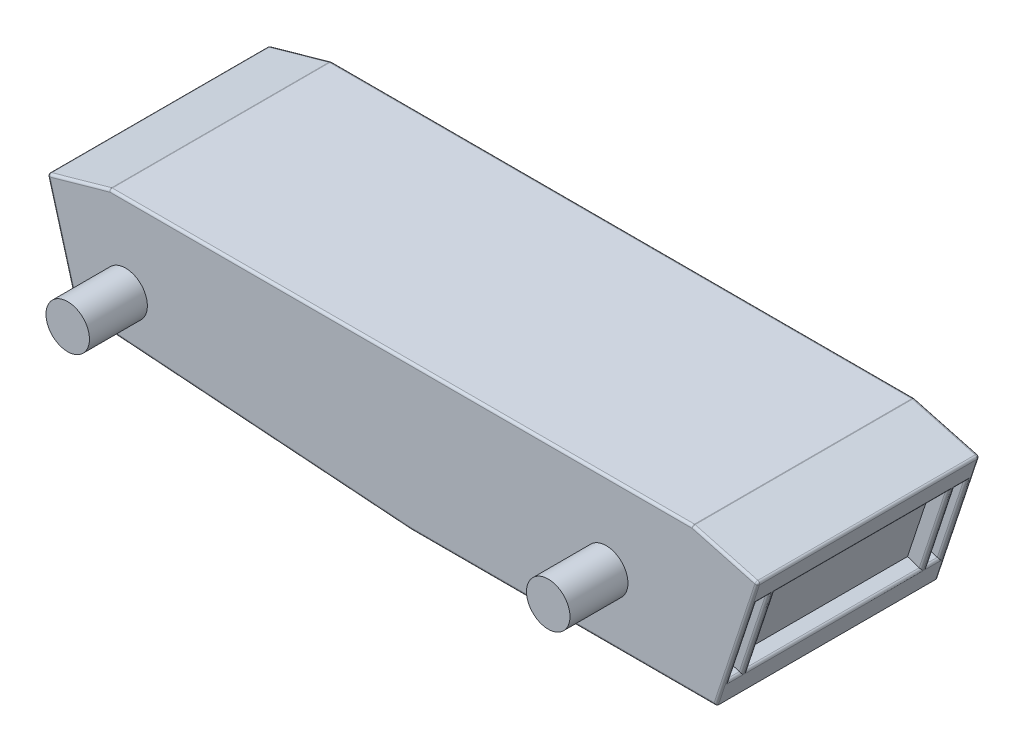
from build123d import *

# Parameters (mm, degrees)
BOSS_EXTRUDE1_DEPTH      = 116.84
BOSS_EXTRUDE1_DEPTH_BACK = 116.84
SKETCH4_W                = 182.88
SKETCH4_H                = 90.042714046
SKETCH4_W_2              = 12.7
CUT_EXTRUDE1_DEPTH       = 15.494
FILLET1_R                = 2.54
FILLET2_R                = 2.54
CUT_EXTRUDE2_DEPTH       = 101.6
CUT_EXTRUDE2_DEPTH_BACK  = 101.6
FILLET3_R                = 2.54
SKETCH6_W                = 177.8
SKETCH6_H                = 57.631536049
CUT_EXTRUDE3_DEPTH       = 13.97
FILLET4_R                = 2.54
BOSS_EXTRUDE3_DEPTH      = 177.8
BOSS_EXTRUDE3_DEPTH_BACK = 177.8
SKETCH8_R                = 22.86
CUT_EXTRUDE4_DEPTH       = 118.364


with BuildPart() as part:
    # Sketch3 → Boss-Extrude1 (new, two sides: drawn at the far end of the back side and taken through both)
    with BuildSketch(Plane.XY.offset(-BOSS_EXTRUDE1_DEPTH_BACK)):
        Polygon((412.345301331, 143.176532362), (343.429290034, 161.691281666), (-269.614631353, 161.691281666), (-335.444851099, 143.176532362), (-304.916459035, 34.631138356), (47.193301176, 9.458898503), (368.115622439, 9.458898503), align=None)
    extrude(amount=BOSS_EXTRUDE1_DEPTH + BOSS_EXTRUDE1_DEPTH_BACK)

    # Sketch4 → Cut-Extrude1 (cut)
    with BuildSketch(Plane(origin=(328.992414347, -108.820567822, 0), x_dir=(0, 0, -1), z_dir=(0.9494110843087806, -0.3140359740405954, 0))):
        with Locations((0, 195.003288159)):
            Rectangle(SKETCH4_W, SKETCH4_H)
        with Locations((-104.14, 195.003288159)):
            Rectangle(SKETCH4_W_2, SKETCH4_H)
        with Locations((104.14, 195.003288159)):
            Rectangle(SKETCH4_W_2, SKETCH4_H)
    extrude(amount=-CUT_EXTRUDE1_DEPTH, mode=Mode.SUBTRACT)

    # Fillet1
    fillet1_edges = [part.edges().sort_by_distance(p)[0] for p in [
        (404.36878759, 119.061490821, -104.14),
        (390.230461885, 76.317715433, -110.49),
        (361.381960839, 38.439613426, -104.14),
        (375.520286544, 81.183388814, -97.79),
        (389.65861225, 123.927164203, -104.14),
        (375.520286544, 81.183388814, -110.49),
        (390.230461885, 76.317715433, -97.79),
        (376.092136179, 33.573940044, -104.14),
        (390.230461885, 76.317715433, 97.79),
        (376.092136179, 33.573940044, 104.14),
        (375.520286544, 81.183388814, 110.49),
        (389.65861225, 123.927164203, 104.14),
        (375.520286544, 81.183388814, 97.79),
        (361.381960839, 38.439613426, 104.14),
        (404.36878759, 119.061490821, 104.14),
        (390.230461885, 76.317715433, 110.49),
    ]]
    fillet(fillet1_edges, radius=FILLET1_R)

    # Fillet2
    fillet2_edges = [part.edges().sort_by_distance(p)[0] for p in [
        (390.230461885, 76.317715433, -91.44),
        (404.36878759, 119.061490821, 0),
        (390.230461885, 76.317715433, 91.44),
        (376.092136179, 33.573940044, 0),
    ]]
    fillet(fillet2_edges, radius=FILLET2_R)

    # Sketch5 → Cut-Extrude2 (cut, two sides: drawn at the far end of the back side and taken through both)
    with BuildSketch(Plane.XY.offset(-CUT_EXTRUDE2_DEPTH_BACK)):
        Polygon((379.785771188, 125.623196843), (340.076788789, 136.291281666), (-266.110728793, 136.291281666), (-304.116579565, 125.602136136), (-285.29852031, 58.693481005), (48.100063951, 34.858898503), (349.763734045, 34.858898503), align=None)
    extrude(amount=CUT_EXTRUDE2_DEPTH + CUT_EXTRUDE2_DEPTH_BACK, mode=Mode.SUBTRACT)

    # Fillet3
    # the kernel refuses this fillet: 2.54 mm, written as the material it adds along each edge
    with BuildSketch(Plane(origin=(48.100063951, 34.858898503, 101.826690694), x_dir=(1, 0, 0), z_dir=(0, 0, -1))) as fillet3_piece_1:
        with BuildLine():
            CenterArc((FILLET3_R * 0.0356993218371, -FILLET3_R), FILLET3_R, 90, 4.089104427)
            Line((-FILLET3_R * 0.0356084442551, -FILLET3_R * 0.00254563889121), (0, 0))
            Line((0, 0), (FILLET3_R * 0.0356993218371, 0))
        make_face()
    extrude(amount=203.653381387)
    # the kernel refuses this fillet: 2.54 mm, written as the material it takes off along each edge
    with BuildSketch(Plane(origin=(47.283977453, 11.998898503, 114.3), x_dir=(-0.07130776609221037, -0.9974543611087873, 0), z_dir=(0, 0, 1))) as fillet3_2_piece_1_section:
        Polygon((0, 0), (FILLET3_R * 1.02, 0), (FILLET3_R * 1.02, FILLET3_R * 0.0364133082739), (FILLET3_R * 1.01740344833, FILLET3_R * 0.0727339214141), align=None)
    fillet3_2_piece_1 = extrude(amount=FILLET3_R * 1.02, mode=Mode.PRIVATE)
    fillet3_2_piece_1 = fillet3_2_piece_1 - Plane(origin=(47.283977453, 11.998898503, 114.3), x_dir=(0.035676595207593184, 0.9993633876395481, 0), z_dir=(0, 0, 1)) * Sphere(FILLET3_R, mode=Mode.PRIVATE)
    add(fillet3_2_piece_1, mode=Mode.SUBTRACT)
    with BuildSketch(Plane(origin=(47.283977453, 11.998898503, -114.3), x_dir=(-0.07130776609221037, -0.9974543611087873, 0), z_dir=(0, 0, -1))) as fillet3_2_piece_2_section:
        Polygon((0, 0), (FILLET3_R * 1.02, 0), (FILLET3_R * 1.02, -FILLET3_R * 0.0364133082739), (FILLET3_R * 1.01740344833, -FILLET3_R * 0.0727339214141), align=None)
    fillet3_2_piece_2 = extrude(amount=FILLET3_R * 1.02, mode=Mode.PRIVATE)
    fillet3_2_piece_2 = fillet3_2_piece_2 - Plane(origin=(47.283977453, 11.998898503, -114.3), x_dir=(0.035676595207593184, 0.9993633876395481, 0), z_dir=(0, 0, -1)) * Sphere(FILLET3_R, mode=Mode.PRIVATE)
    add(fillet3_2_piece_2, mode=Mode.SUBTRACT)
    with BuildSketch(Plane(origin=(-302.954665162, 37.03737262, -114.3), x_dir=(-0.9626509401538987, -0.27074557691828516, 0), z_dir=(0, 0, -1))) as fillet3_2_piece_3_section:
        Polygon((0, 0), (FILLET3_R * 1.02, 0), (FILLET3_R * 1.02, -FILLET3_R * 0.716898030256), (FILLET3_R * 0.345474861407, -FILLET3_R * 0.959711998537), align=None)
    fillet3_2_piece_3 = extrude(amount=FILLET3_R * 1.02, mode=Mode.PRIVATE)
    fillet3_2_piece_3 = fillet3_2_piece_3 - Plane(origin=(-302.954665162, 37.03737262, -114.3), x_dir=(0.6318971956026084, 0.7750522138472729, 0), z_dir=(0, 0, -1)) * Sphere(FILLET3_R, mode=Mode.PRIVATE)
    add(fillet3_2_piece_3, mode=Mode.SUBTRACT)
    with BuildSketch(Plane(origin=(-302.954665162, 37.03737262, 114.3), x_dir=(-0.9626509401538987, -0.27074557691828516, 0), z_dir=(0, 0, 1))) as fillet3_2_piece_4_section:
        Polygon((0, 0), (FILLET3_R * 1.02, 0), (FILLET3_R * 1.02, FILLET3_R * 0.716898030256), (FILLET3_R * 0.345474861407, FILLET3_R * 0.959711998537), align=None)
    fillet3_2_piece_4 = extrude(amount=FILLET3_R * 1.02, mode=Mode.PRIVATE)
    fillet3_2_piece_4 = fillet3_2_piece_4 - Plane(origin=(-302.954665162, 37.03737262, 114.3), x_dir=(0.6318971956026084, 0.7750522138472729, 0), z_dir=(0, 0, 1)) * Sphere(FILLET3_R, mode=Mode.PRIVATE)
    add(fillet3_2_piece_4, mode=Mode.SUBTRACT)
    with BuildSketch(Plane(origin=(343.094039909, 159.151281666, -114.3), x_dir=(0.25945651134605857, 0.9657547922325483, 0), z_dir=(0, 0, -1))) as fillet3_2_piece_5_section:
        Polygon((0, 0), (FILLET3_R * 1.02, 0), (FILLET3_R * 1.02, -FILLET3_R * 0.134628002749), (FILLET3_R * 0.985069888077, -FILLET3_R * 0.264645641573), align=None)
    fillet3_2_piece_5 = extrude(amount=FILLET3_R * 1.02, mode=Mode.PRIVATE)
    fillet3_2_piece_5 = fillet3_2_piece_5 - Plane(origin=(343.094039909, 159.151281666, -114.3), x_dir=(-0.13085336787307325, -0.9914017329600923, 0), z_dir=(0, 0, -1)) * Sphere(FILLET3_R, mode=Mode.PRIVATE)
    add(fillet3_2_piece_5, mode=Mode.SUBTRACT)
    with BuildSketch(Plane(origin=(-269.264241097, 159.151281666, -114.3), x_dir=(-0.270745576918285, 0.9626509401538987, 0), z_dir=(0, 0, -1))) as fillet3_2_piece_6_section:
        Polygon((0, 0), (FILLET3_R * 1.02, 0), (FILLET3_R * 1.02, FILLET3_R * 0.140707898081), (FILLET3_R * 0.981903958957, FILLET3_R * 0.276160488457), align=None)
    fillet3_2_piece_6 = extrude(amount=FILLET3_R * 1.02, mode=Mode.PRIVATE)
    fillet3_2_piece_6 = fillet3_2_piece_6 - Plane(origin=(-269.264241097, 159.151281666, -114.3), x_dir=(0.13665478375472503, -0.9906187309338288, 0), z_dir=(0, 0, -1)) * Sphere(FILLET3_R, mode=Mode.PRIVATE)
    add(fillet3_2_piece_6, mode=Mode.SUBTRACT)
    with BuildSketch(Plane(origin=(-332.312023946, 141.41909274, -114.3), x_dir=(-0.270745576918285, 0.9626509401538987, 0), z_dir=(0, 0, -1))) as fillet3_2_piece_7_section:
        Polygon((0, 0), (FILLET3_R * 1.02, 0), (FILLET3_R * 1.02, -FILLET3_R * 1.02), (0, -FILLET3_R * 1.02), align=None)
    fillet3_2_piece_7 = extrude(amount=FILLET3_R * 1.02, mode=Mode.PRIVATE)
    fillet3_2_piece_7 = fillet3_2_piece_7 - Plane(origin=(-332.312023946, 141.41909274, -114.3), x_dir=(0.8721430411136103, -0.48925097428324366, 0), z_dir=(0, 0, -1)) * Sphere(FILLET3_R, mode=Mode.PRIVATE)
    add(fillet3_2_piece_7, mode=Mode.SUBTRACT)
    with BuildSketch(Plane(origin=(-332.312023946, 141.41909274, 114.3), x_dir=(-0.270745576918285, 0.9626509401538987, 0), z_dir=(0, 0, 1))) as fillet3_2_piece_8_section:
        Polygon((0, 0), (FILLET3_R * 1.02, 0), (FILLET3_R * 1.02, FILLET3_R * 1.02), (0, FILLET3_R * 1.02), align=None)
    fillet3_2_piece_8 = extrude(amount=FILLET3_R * 1.02, mode=Mode.PRIVATE)
    fillet3_2_piece_8 = fillet3_2_piece_8 - Plane(origin=(-332.312023946, 141.41909274, 114.3), x_dir=(0.8721430411136103, -0.48925097428324366, 0), z_dir=(0, 0, 1)) * Sphere(FILLET3_R, mode=Mode.PRIVATE)
    add(fillet3_2_piece_8, mode=Mode.SUBTRACT)
    with BuildSketch(Plane(origin=(-269.264241097, 159.151281666, 114.3), x_dir=(0, 1, 0), z_dir=(0, 0, 1))) as fillet3_2_piece_9_section:
        Polygon((0, 0), (FILLET3_R * 1.02, 0), (FILLET3_R * 1.02, FILLET3_R * 0.140707898081), (FILLET3_R * 0.981903958957, FILLET3_R * 0.276160488457), align=None)
    fillet3_2_piece_9 = extrude(amount=FILLET3_R * 1.02, mode=Mode.PRIVATE)
    fillet3_2_piece_9 = fillet3_2_piece_9 - Plane(origin=(-269.264241097, 159.151281666, 114.3), x_dir=(0.13665478375472503, -0.9906187309338288, 0), z_dir=(0, 0, 1)) * Sphere(FILLET3_R, mode=Mode.PRIVATE)
    add(fillet3_2_piece_9, mode=Mode.SUBTRACT)
    with BuildSketch(Plane(origin=(343.094039909, 159.151281666, 114.3), x_dir=(0.25945651134605857, 0.9657547922325483, 0), z_dir=(0, 0, 1))) as fillet3_2_piece_10_section:
        Polygon((0, 0), (FILLET3_R * 1.02, 0), (FILLET3_R * 1.02, FILLET3_R * 0.134628002749), (FILLET3_R * 0.985069888077, FILLET3_R * 0.264645641573), align=None)
    fillet3_2_piece_10 = extrude(amount=FILLET3_R * 1.02, mode=Mode.PRIVATE)
    fillet3_2_piece_10 = fillet3_2_piece_10 - Plane(origin=(343.094039909, 159.151281666, 114.3), x_dir=(-0.13085336787307325, -0.9914017329600923, 0), z_dir=(0, 0, 1)) * Sphere(FILLET3_R, mode=Mode.PRIVATE)
    add(fillet3_2_piece_10, mode=Mode.SUBTRACT)
    with BuildSketch(Plane(origin=(409.089348316, 141.42119881, 114.3), x_dir=(0.25945651134605857, 0.9657547922325483, 0), z_dir=(0, 0, 1))) as fillet3_2_piece_11_section:
        Polygon((0, 0), (FILLET3_R * 1.02, 0), (FILLET3_R * 1.02, -FILLET3_R * 1.07984247927), (-FILLET3_R * 0.058089876277, -FILLET3_R * 1.01834452239), align=None)
    fillet3_2_piece_11 = extrude(amount=FILLET3_R * 1.02, mode=Mode.PRIVATE)
    fillet3_2_piece_11 = fillet3_2_piece_11 - Plane(origin=(409.089348316, 141.42119881, 114.3), x_dir=(-0.8802308318365007, -0.47454576458379855, 0), z_dir=(0, 0, 1)) * Sphere(FILLET3_R, mode=Mode.PRIVATE)
    add(fillet3_2_piece_11, mode=Mode.SUBTRACT)
    with BuildSketch(Plane(origin=(409.089348316, 141.42119881, -114.3), x_dir=(0.25945651134605857, 0.9657547922325483, 0), z_dir=(0, 0, -1))) as fillet3_2_piece_12_section:
        Polygon((0, 0), (FILLET3_R * 1.02, 0), (FILLET3_R * 1.02, FILLET3_R * 1.07984247927), (-FILLET3_R * 0.058089876277, FILLET3_R * 1.01834452239), align=None)
    fillet3_2_piece_12 = extrude(amount=FILLET3_R * 1.02, mode=Mode.PRIVATE)
    fillet3_2_piece_12 = fillet3_2_piece_12 - Plane(origin=(409.089348316, 141.42119881, -114.3), x_dir=(-0.8802308318365007, -0.47454576458379855, 0), z_dir=(0, 0, -1)) * Sphere(FILLET3_R, mode=Mode.PRIVATE)
    add(fillet3_2_piece_12, mode=Mode.SUBTRACT)
    with BuildSketch(Plane(origin=(47.193301176, 9.458898503, 114.3), x_dir=(1, 0, 0), z_dir=(0, 0, -1))) as fillet3_2_piece_13:
        with BuildLine():
            CenterArc((FILLET3_R * 0.0356993218371, -FILLET3_R), FILLET3_R, 90, 4.089104427)
            Line((-FILLET3_R * 0.0356084442551, -FILLET3_R * 0.00254563889121), (0, 0))
            Line((0, 0), (FILLET3_R * 0.0356993218371, 0))
        make_face()
    extrude(amount=228.6, mode=Mode.SUBTRACT)
    with BuildSketch(Plane(origin=(-304.916459035, 34.631138356, -114.3), x_dir=(0.9974543611087872, -0.07130776609221003, 0), z_dir=(0, 0, 1))) as fillet3_2_piece_14:
        with BuildLine():
            CenterArc((FILLET3_R * 0.702841206134, FILLET3_R), FILLET3_R, 199.797742256, 70.202257744)
            Line((-FILLET3_R * 0.238052910079, FILLET3_R * 0.661299155483), (0, 0))
            Line((0, 0), (FILLET3_R * 0.702841206134, 0))
        make_face()
    extrude(amount=228.6, mode=Mode.SUBTRACT)
    with BuildSketch(Plane(origin=(343.094039909, 161.691281666, -116.84), x_dir=(0, -1, 0), z_dir=(-1, 0, 0))) as fillet3_2_piece_15:
        with BuildLine():
            CenterArc((FILLET3_R, FILLET3_R), FILLET3_R, 180, 90)
            Line((0, FILLET3_R), (0, 0))
            Line((0, 0), (FILLET3_R, 0))
        make_face()
    extrude(amount=612.358281006, mode=Mode.SUBTRACT)
    with BuildSketch(Plane(origin=(-335.444851099, 143.176532362, -114.3), x_dir=(0.9626509401538971, 0.27074557691829054, 0), z_dir=(0, 0, 1))) as fillet3_2_piece_16:
        with BuildLine():
            CenterArc((FILLET3_R, -FILLET3_R), FILLET3_R, 90, 90)
            Line((0, -FILLET3_R), (0, 0))
            Line((0, 0), (FILLET3_R, 0))
        make_face()
    extrude(amount=228.6, mode=Mode.SUBTRACT)
    with BuildSketch(Plane(origin=(-269.614631353, 161.691281666, -114.3), x_dir=(1, 0, 0), z_dir=(0, 0, 1))) as fillet3_2_piece_17:
        with BuildLine():
            CenterArc((FILLET3_R * 0.137948919688, -FILLET3_R), FILLET3_R, 90, 15.708637829)
            Line((-FILLET3_R * 0.132796657231, -FILLET3_R * 0.0373490598461), (0, 0))
            Line((0, 0), (FILLET3_R * 0.137948919688, 0))
        make_face()
    extrude(amount=228.6, mode=Mode.SUBTRACT)
    with BuildSketch(Plane(origin=(343.429290034, 161.691281666, -114.3), x_dir=(0.9657547922325409, -0.2594565113460861, 0), z_dir=(0, 0, 1))) as fillet3_2_piece_18:
        with BuildLine():
            CenterArc((FILLET3_R * 0.131988237989, -FILLET3_R), FILLET3_R, 90, 15.037815904)
            Line((-FILLET3_R * 0.127468273357, -FILLET3_R * 0.0342452077675), (0, 0))
            Line((0, 0), (FILLET3_R * 0.131988237989, 0))
        make_face()
    extrude(amount=228.6, mode=Mode.SUBTRACT)
    with BuildSketch(Plane(origin=(412.345301331, 143.176532362, 114.3), x_dir=(-0.3140359740405999, -0.9494110843087791, 0), z_dir=(0, 0, -1))) as fillet3_2_piece_19:
        with BuildLine():
            CenterArc((FILLET3_R * 1.05866909732, FILLET3_R), FILLET3_R, 176.735189662, 93.264810338)
            Line((FILLET3_R * 0.0602921145899, FILLET3_R * 1.0569508591), (0, 0))
            Line((0, 0), (FILLET3_R * 1.05866909732, 0))
        make_face()
    extrude(amount=228.6, mode=Mode.SUBTRACT)
    with BuildSketch(Plane(origin=(-269.951934862, 161.596415054, -116.84), x_dir=(0.270745576918285, -0.9626509401538987, 5.594824691024432e-15), z_dir=(-0.9626509401538987, -0.270745576918285, 0))) as fillet3_2_piece_20:
        with BuildLine():
            CenterArc((FILLET3_R, FILLET3_R), FILLET3_R, 180, 90)
            Line((0, FILLET3_R), (0, 0))
            Line((0, 0), (FILLET3_R, 0))
        make_face()
    extrude(amount=65.493919155, mode=Mode.SUBTRACT)
    with BuildSketch(Plane(origin=(-334.757157334, 140.731398974, -116.84), x_dir=(0.9626509401538985, 0.27074557691828516, 5.594824691024432e-15), z_dir=(0.2707455769182851, -0.9626509401538986, 0))) as fillet3_2_piece_21:
        with BuildLine():
            CenterArc((FILLET3_R, FILLET3_R), FILLET3_R, 180, 90)
            Line((0, FILLET3_R), (0, 0))
            Line((0, 0), (FILLET3_R, 0))
        make_face()
    extrude(amount=108.431536048, mode=Mode.SUBTRACT)
    with BuildSketch(Plane(origin=(366.121494004, 3.430138118, 116.84), x_dir=(0, 0, -1), z_dir=(0.3140359740405954, 0.9494110843087806, 0))) as fillet3_2_piece_22:
        with BuildLine():
            CenterArc((FILLET3_R, FILLET3_R), FILLET3_R, 180, 90)
            Line((0, FILLET3_R), (0, 0))
            Line((0, 0), (FILLET3_R, 0))
        make_face()
    extrude(amount=144.503694539, mode=Mode.SUBTRACT)
    with BuildSketch(Plane(origin=(409.748367855, 143.874215983, 116.84), x_dir=(-0.25945651134605857, -0.9657547922325482, -5.594824691024398e-15), z_dir=(-0.9657547922325483, 0.25945651134605857, 0))) as fillet3_2_piece_23:
        with BuildLine():
            CenterArc((FILLET3_R, -FILLET3_R), FILLET3_R, 90, 90)
            Line((0, -FILLET3_R), (0, 0))
            Line((0, 0), (FILLET3_R, 0))
        make_face()
    extrude(amount=68.335470803, mode=Mode.SUBTRACT)
    with BuildSketch(Plane(origin=(343.094039909, 161.691281666, 116.84), x_dir=(0, -1, 0), z_dir=(-1, 0, 0))) as fillet3_2_piece_24:
        with BuildLine():
            CenterArc((FILLET3_R, -FILLET3_R), FILLET3_R, 90, 90)
            Line((0, -FILLET3_R), (0, 0))
            Line((0, 0), (FILLET3_R, 0))
        make_face()
    extrude(amount=612.358281006, mode=Mode.SUBTRACT)
    with BuildSketch(Plane(origin=(-269.951934862, 161.596415054, 116.84), x_dir=(0.270745576918285, -0.9626509401538987, -5.594824691024432e-15), z_dir=(-0.9626509401538987, -0.270745576918285, 0))) as fillet3_2_piece_25:
        with BuildLine():
            CenterArc((FILLET3_R, -FILLET3_R), FILLET3_R, 90, 90)
            Line((0, -FILLET3_R), (0, 0))
            Line((0, 0), (FILLET3_R, 0))
        make_face()
    extrude(amount=65.493919155, mode=Mode.SUBTRACT)
    with BuildSketch(Plane(origin=(-334.757157334, 140.731398974, 116.84), x_dir=(0.9626509401538985, 0.27074557691828516, -5.594824691024432e-15), z_dir=(0.2707455769182851, -0.9626509401538986, 0))) as fillet3_2_piece_26:
        with BuildLine():
            CenterArc((FILLET3_R, -FILLET3_R), FILLET3_R, 90, 90)
            Line((0, -FILLET3_R), (0, 0))
            Line((0, 0), (FILLET3_R, 0))
        make_face()
    extrude(amount=108.431536048, mode=Mode.SUBTRACT)
    with BuildSketch(Plane(origin=(-303.135786888, 34.503838543, 116.84), x_dir=(0.07130776609221036, 0.997454361108787, -5.594824691024416e-15), z_dir=(0.997454361108787, -0.07130776609221036, 0))) as fillet3_2_piece_27:
        with BuildLine():
            CenterArc((FILLET3_R, -FILLET3_R), FILLET3_R, 90, 90)
            Line((0, -FILLET3_R), (0, 0))
            Line((0, 0), (FILLET3_R, 0))
        make_face()
    extrude(amount=351.132499161, mode=Mode.SUBTRACT)
    with BuildSketch(Plane(origin=(47.283977453, 9.458898503, 116.84), x_dir=(0, 0, -1), z_dir=(1, 0, 0))) as fillet3_2_piece_28:
        with BuildLine():
            CenterArc((FILLET3_R, FILLET3_R), FILLET3_R, 180, 90)
            Line((0, FILLET3_R), (0, 0))
            Line((0, 0), (FILLET3_R, 0))
        make_face()
    extrude(amount=327.181644985, mode=Mode.SUBTRACT)
    with BuildSketch(Plane(origin=(-303.135786888, 34.503838543, -116.84), x_dir=(0.07130776609221036, 0.997454361108787, 5.594824691024416e-15), z_dir=(0.997454361108787, -0.07130776609221036, 0))) as fillet3_2_piece_29:
        with BuildLine():
            CenterArc((FILLET3_R, FILLET3_R), FILLET3_R, 180, 90)
            Line((0, FILLET3_R), (0, 0))
            Line((0, 0), (FILLET3_R, 0))
        make_face()
    extrude(amount=351.132499161, mode=Mode.SUBTRACT)
    with BuildSketch(Plane(origin=(47.283977453, 9.458898503, -116.84), x_dir=(0, 0, 1), z_dir=(1, 0, 0))) as fillet3_2_piece_30:
        with BuildLine():
            CenterArc((FILLET3_R, -FILLET3_R), FILLET3_R, 90, 90)
            Line((0, -FILLET3_R), (0, 0))
            Line((0, 0), (FILLET3_R, 0))
        make_face()
    extrude(amount=327.181644985, mode=Mode.SUBTRACT)
    with BuildSketch(Plane(origin=(366.121494004, 3.430138118, -116.84), x_dir=(0, 0, 1), z_dir=(0.3140359740405954, 0.9494110843087806, 0))) as fillet3_2_piece_31:
        with BuildLine():
            CenterArc((FILLET3_R, -FILLET3_R), FILLET3_R, 90, 90)
            Line((0, -FILLET3_R), (0, 0))
            Line((0, 0), (FILLET3_R, 0))
        make_face()
    extrude(amount=144.503694539, mode=Mode.SUBTRACT)
    with BuildSketch(Plane(origin=(409.748367855, 143.874215983, -116.84), x_dir=(-0.25945651134605857, -0.9657547922325482, 5.594824691024398e-15), z_dir=(-0.9657547922325483, 0.25945651134605857, 0))) as fillet3_2_piece_32:
        with BuildLine():
            CenterArc((FILLET3_R, FILLET3_R), FILLET3_R, 180, 90)
            Line((0, FILLET3_R), (0, 0))
            Line((0, 0), (FILLET3_R, 0))
        make_face()
    extrude(amount=68.335470803, mode=Mode.SUBTRACT)

    # Sketch6 → Cut-Extrude3 (cut)
    with BuildSketch(Plane(origin=(-273.539082538, -76.932866964, 0), x_dir=(0, 0, 1), z_dir=(-0.9626509401538986, -0.27074557691828505, 0))):
        with Locations((0, 171.893465198)):
            Rectangle(SKETCH6_W, SKETCH6_H)
    extrude(amount=-CUT_EXTRUDE3_DEPTH, mode=Mode.SUBTRACT)

    # Fillet4
    fillet4_edges = [part.edges().sort_by_distance(p)[0] for p in [
        (-306.630244308, 92.322854624, -88.9),
        (-314.431986046, 120.062380804, 0),
        (-306.630244308, 92.322854624, 88.9),
        (-298.82850257, 64.583328445, 0),
        (-320.078477942, 88.540538915, -88.9),
        (-312.276736204, 60.801012735, 0),
        (-320.078477942, 88.540538915, 88.9),
        (-327.88021968, 116.280065095, 0),
    ]]
    fillet(fillet4_edges, radius=FILLET4_R)

    # Sketch8 → Boss-Extrude3 (add, two sides: drawn at the far end of the back side and taken through both)
    with BuildSketch(Plane.XY.offset(-BOSS_EXTRUDE3_DEPTH_BACK)):
        with Locations((-252.728784754, 75.375033192)):
            Circle(SKETCH8_R)
        with Locations((252.728784754, 75.375033192)):
            Circle(SKETCH8_R)
    extrude(amount=BOSS_EXTRUDE3_DEPTH + BOSS_EXTRUDE3_DEPTH_BACK)

    # Sketch9 → Cut-Extrude4 (cut)
    with BuildSketch(Plane(origin=(0, 0, -116.84), x_dir=(-1, 0, 0), z_dir=(0, 0, -1))):
        Polygon((165.217039659, 123.1520317), (95.341147185, 123.1520317), (-65.570239005, 123.1520317), (-65.570239005, 103.960765457), (165.217039659, 103.960765457), align=None)
    extrude(amount=-CUT_EXTRUDE4_DEPTH, mode=Mode.SUBTRACT)


solid = part.part
